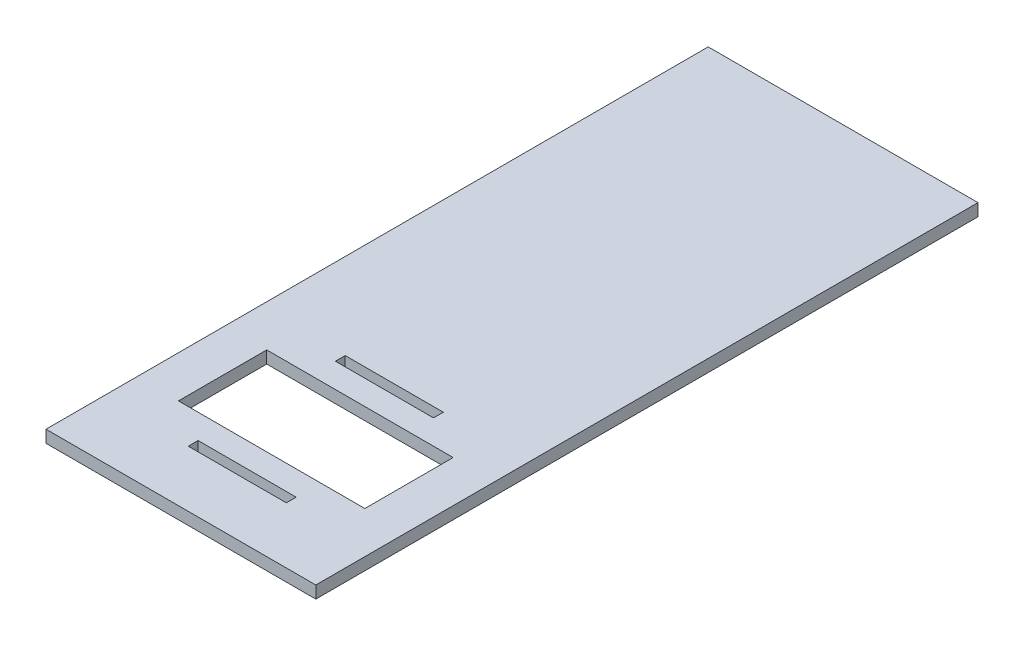
from build123d import *

# Parameters (mm, degrees)
SKETCH1_W           = 139.7
SKETCH1_H           = 342.9
BOSS_EXTRUDE1_DEPTH = 6.35
SKETCH2_W           = 96.52
SKETCH2_H           = 45.72
CUT_EXTRUDE1_DEPTH  = 282.914255581
SKETCH3_W           = 50.8
SKETCH3_H           = 5.08
NEOPIXEL_DEPTH      = 282.914255581
SKETCH4_R           = 1.016
CUT_EXTRUDE3_DEPTH  = 5.08


with BuildPart() as part:
    # Sketch1 → Boss-Extrude1 (new body)
    with BuildSketch(Plane(origin=(0, 0, 0), x_dir=(1, 0, 0), z_dir=(0, 1, 0))):
        with Locations((0, 101.6)):
            Rectangle(SKETCH1_W, SKETCH1_H)
    extrude(amount=BOSS_EXTRUDE1_DEPTH)

    # Sketch2 → Cut-Extrude1 (cut, through all)
    with BuildSketch(Plane(origin=(0, 6.35, 0), x_dir=(1, 0, 0), z_dir=(0, 1, 0))):
        Rectangle(SKETCH2_W, SKETCH2_H)
    extrude(amount=-CUT_EXTRUDE1_DEPTH, mode=Mode.SUBTRACT)

    # Sketch3 → NeoPixel (cut, through all)
    with BuildSketch(Plane(origin=(0, 6.35, 0), x_dir=(1, 0, 0), z_dir=(0, 1, 0))):
        with Locations((0, 38.1)):
            Rectangle(SKETCH3_W, SKETCH3_H)
    neopixel = extrude(amount=-NEOPIXEL_DEPTH, mode=Mode.SUBTRACT)

    # Sketch4 → Cut-Extrude3 (cut)
    with BuildSketch(Plane.XZ):
        with Locations((13.208, -42.164)):
            Circle(SKETCH4_R)
        with Locations((-13.208, -42.164)):
            Circle(SKETCH4_R)
    cut_extrude3 = extrude(amount=-CUT_EXTRUDE3_DEPTH, mode=Mode.SUBTRACT)

    # Mirror2: NeoPixel, Cut-Extrude3 across plane
    add(neopixel.mirror(Plane.XY), mode=Mode.SUBTRACT)
    add(cut_extrude3.mirror(Plane.XY), mode=Mode.SUBTRACT)


solid = part.part
